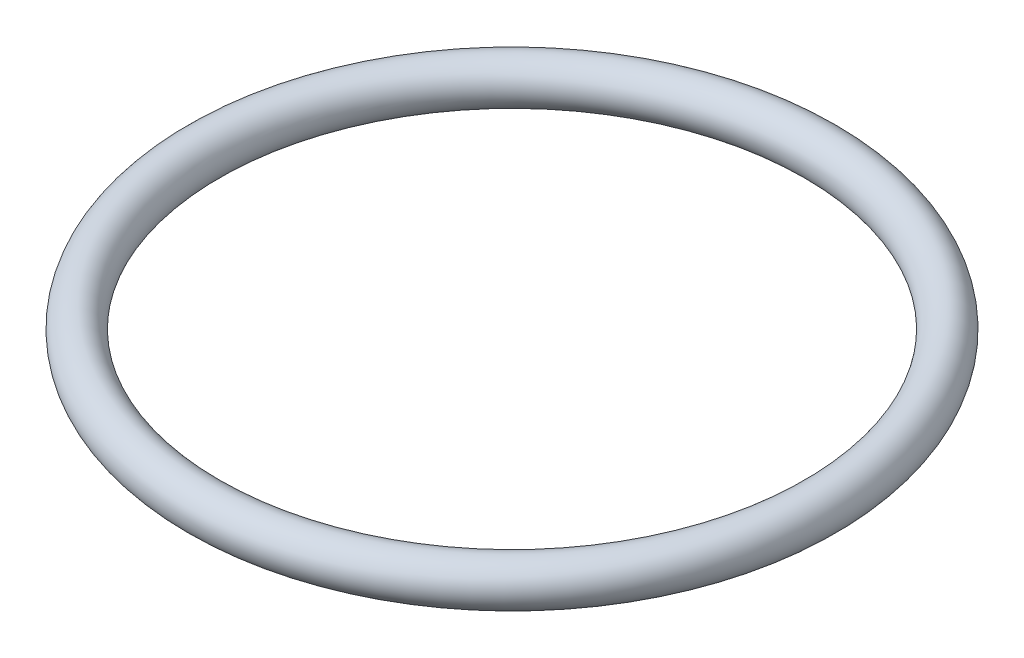
from build123d import *

# Parameters (mm, degrees)
SKETCH1_R = 0.9


with BuildPart() as part:
    # Sketch1 → Revolve1 (revolve)
    with BuildSketch(Plane(origin=(0, 0, 0), x_dir=(0, 0, -1), z_dir=(1, 0, 0))):
        with Locations((-12.75, 0)):
            Circle(SKETCH1_R)
    revolve(axis=Axis((0, -6.843396226, 0), (0, 1, 0)))


solid = part.part
